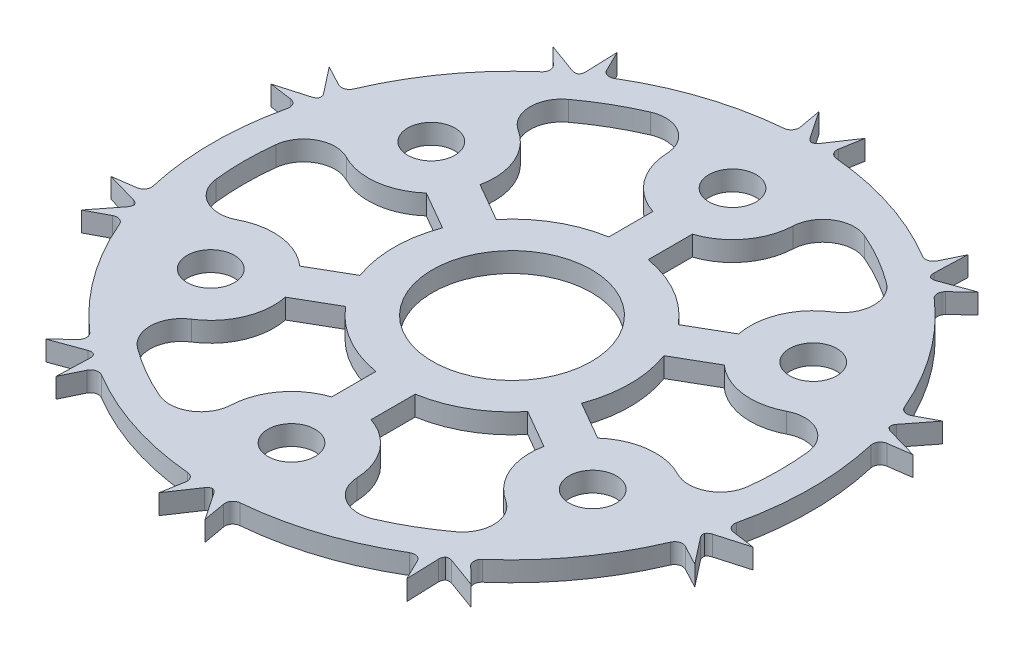
from build123d import *
from build123d.topology import SkipClean

# Parameters (mm, degrees)
SKETCH1_R                = 25.4
BOSS_EXTRUDE1_DEPTH      = 7.62
CUT_EXTRUDE4_DEPTH       = 0.635
CIRPATTERN2_COUNT        = 20
BOSS_EXTRUDE2_REACH      = 36.931
SKETCH5_R                = 3.81
SKETCH5_R_2              = 1.397
BOSS_EXTRUDE6_REACH      = 36.931
SKETCH12_R               = 3.81
SKETCH17_R               = 1.397
CUT_EXTRUDE5_DEPTH       = 33.341392346
CIRPATTERN1_COUNT        = 3
CUT_EXTRUDE7_DEPTH       = 33.67002223
SKETCH30_R               = 24.13
SKETCH30_R_2             = 21.59
BOSS_EXTRUDE16_DEPTH     = 1.6002
SKETCH31_R               = 1.905
BOSS_EXTRUDE17_DEPTH     = 1.6002
FILLET6_R                = 2.54
CIRPATTERN8_COUNT        = 6
FILLET6_OF_CIRPATTERN8_R = 2.54
BOSS_EXTRUDE18_DEPTH     = 1.6002
FILLET7_R                = 0.635
CIRPATTERN9_COUNT        = 10
FILLET7_OF_CIRPATTERN9_R = 0.635
SKETCH34_R               = 9.525
SKETCH34_R_2             = 6.4135
BOSS_EXTRUDE19_DEPTH     = 1.6002


with BuildPart() as part:
    # Sketch1 → Boss-Extrude1 (new, symmetric)
    with BuildSketch(Plane(origin=(0, 0, 0), x_dir=(1, 0, 0), z_dir=(0, 1, 0))):
        with Locations(Location((0, 0, 0), (0, 0, 90))):
            Circle(SKETCH1_R)
    extrude(amount=BOSS_EXTRUDE1_DEPTH, both=True)

    # Sketch9 → Cut-Extrude4 (cut)
    with BuildSketch(Plane.ZY.offset(25.4)):
        Polygon((-0.635, -7.62), (0.635, -7.62), (0.635, 0), (0.635, 7.62), (-0.635, 7.62), (-0.635, 0), align=None)
    cut_extrude4 = extrude(amount=-CUT_EXTRUDE4_DEPTH, mode=Mode.SUBTRACT)

    # CirPattern2: Cut-Extrude4 ×20 about axis
    cirpattern2_axis = Axis((0, 0, 0), (0, 1, 0))
    for i in range(1, CIRPATTERN2_COUNT):
        add(cut_extrude4.rotate(cirpattern2_axis, i * 360 / CIRPATTERN2_COUNT), mode=Mode.SUBTRACT)

    # Sketch4 → Cut-Revolve2 (revolve, cut)
    with BuildSketch(Plane.XY, mode=Mode.PRIVATE) as cut_revolve2_sk:
        with BuildLine():
            Line((-25.4, -7.62), (-22.225, -7.62))
            Line((-22.225, -7.62), (-22.225, -5.08))
            Line((-22.225, -5.08), (-13.94687024, -1.768748096))
            ThreePointArc((-13.94687024, -1.768748096), (-12.749369479, 0), (-13.94687024, 1.768748096))
            Line((-13.94687024, 1.768748096), (-22.225, 5.08))
            Line((-22.225, 5.08), (-22.225, 7.62))
            Line((-22.225, 7.62), (-25.4, 7.62))
            Line((-25.4, 7.62), (-25.4, -7.62))
        make_face()
    revolve(cut_revolve2_sk.sketch.rotate(Axis((0, -55, 0), (0, 1, 0)), 270), axis=Axis((0, -55, 0), (0, 1, 0)), mode=Mode.SUBTRACT)

    # Sketch5 → Boss-Extrude2 (add, up to next)
    with BuildSketch(Plane(origin=(0, 7.62, 0), x_dir=(1, 0, 0), z_dir=(0, 1, 0)), mode=Mode.PRIVATE) as boss_extrude2_sk1:
        with Locations(Location((0, 17.78, 0), (0, 0, 135.677409987))):
            Circle(SKETCH5_R)
        with Locations(Location((0, 17.78, 0), (0, 0, 168.148952206))):
            Circle(SKETCH5_R_2, mode=Mode.SUBTRACT)
    boss_extrude2_tool1 = extrude(boss_extrude2_sk1.sketch, amount=-BOSS_EXTRUDE2_REACH, mode=Mode.PRIVATE) - part.part
    boss_extrude2 = boss_extrude2_tool1.solids().sort_by_distance((2.648644, 7.62, -15.193257))[0]
    add(boss_extrude2)

    # Sketch12 → Boss-Extrude6 (add, up to next)
    with BuildSketch(Plane(origin=(0, 7.62, 0), x_dir=(1, 0, 0), z_dir=(0, 1, 0)), mode=Mode.PRIVATE) as boss_extrude6_sk1:
        with Locations(Location((-15.397931679, 8.89, 0), (0, 0, 134.328577967))):
            Circle(SKETCH12_R)
    boss_extrude6_tool1 = extrude(boss_extrude6_sk1.sketch, amount=-BOSS_EXTRUDE6_REACH, mode=Mode.PRIVATE) - part.part
    boss_extrude6 = boss_extrude6_tool1.solids().sort_by_distance((-15.397932, 7.62, -8.89))[0]
    add(boss_extrude6)

    # Sketch17 → Cut-Extrude5 (cut, symmetric)
    with BuildSketch(Plane(origin=(0, 0, 0), x_dir=(1, 0, 0), z_dir=(0, 1, 0))):
        with Locations(Location((0, 17.78, 0), (0, 0, 270))):
            Circle(SKETCH17_R)
        with Locations(Location((-15.397931679, 8.89, 0), (0, 0, 270))):
            Circle(SKETCH17_R)
        with Locations(Location((-15.397931679, -8.89, 0), (0, 0, 270))):
            Circle(SKETCH17_R)
        with BuildLine():
            Line((-18.697488468, -10.795), (-19.247414599, -11.1125))
            ThreePointArc((-19.247414599, -11.1125), (-19.247414599, 11.1125), (0, 22.225))
            Line((0, 22.225), (0, 21.59))
            ThreePointArc((0, 21.59), (-2.694076836, 20.474076836), (-3.81, 17.78))
            Line((-3.81, 17.78), (-3.81, 15.411019596))
            ThreePointArc((-3.81, 15.411019596), (-7.9375, 13.748153285), (-11.441334469, 11.005066587))
            Line((-11.441334469, 11.005066587), (-13.492931679, 12.189556788))
            ThreePointArc((-13.492931679, 12.189556788), (-18.697488468, 10.795), (-17.302931679, 5.590443212))
            Line((-17.302931679, 5.590443212), (-15.251334469, 4.40595301))
            ThreePointArc((-15.251334469, 4.40595301), (-15.875, 0), (-15.251334469, -4.40595301))
            Line((-15.251334469, -4.40595301), (-17.302931679, -5.590443212))
            ThreePointArc((-17.302931679, -5.590443212), (-19.078109077, -7.903899438), (-18.697488468, -10.795))
        make_face()
    cut_extrude5 = extrude(amount=CUT_EXTRUDE5_DEPTH, both=True, mode=Mode.SUBTRACT)

    # CirPattern1: Boss-Extrude2, Boss-Extrude6, Cut-Extrude5 ×3 about axis
    with SkipClean():  # the faces are left unmerged after this step: merging them gives an invalid solid
        cirpattern1_axis = Axis((0, 0, 0), (0, 1, 0))
        add([boss_extrude2.rotate(cirpattern1_axis, i * 360 / CIRPATTERN1_COUNT) for i in range(1, CIRPATTERN1_COUNT)])
        add([boss_extrude6.rotate(cirpattern1_axis, i * 360 / CIRPATTERN1_COUNT) for i in range(1, CIRPATTERN1_COUNT)])
        add([cut_extrude5.rotate(cirpattern1_axis, i * 360 / CIRPATTERN1_COUNT) for i in range(1, CIRPATTERN1_COUNT)], mode=Mode.SUBTRACT)

    # Sketch24 → Cut-Extrude7 (cut, through all)
    with BuildSketch(Plane.XZ.offset(7.62)):
        Polygon((5.499261314, -9.525), (10.998522628, 0), (5.499261314, 9.525), (-5.499261314, 9.525), (-10.998522628, 0), (-5.499261314, -9.525), align=None)
    extrude(amount=-CUT_EXTRUDE7_DEPTH, mode=Mode.SUBTRACT)


with BuildPart() as body_2:
    # Sketch30 → Boss-Extrude16 (new body)
    with BuildSketch(Plane.XZ.offset(7.62)):
        with Locations(Location((0, 0, 0), (0, 0, 270))):
            Circle(SKETCH30_R)
        with Locations(Location((0, 0, 0), (0, 0, 270))):
            Circle(SKETCH30_R_2, mode=Mode.SUBTRACT)
    extrude(amount=BOSS_EXTRUDE16_DEPTH)

    # Sketch31 → Boss-Extrude17 (add)
    with BuildSketch(Plane.XZ.offset(9.2202)):
        with BuildLine():
            Line((-5.08, 17.78), (-5.08, 23.589203039))
            Line((-5.08, 23.589203039), (5.08, 23.589203039))
            Line((5.08, 23.589203039), (5.08, 17.78))
            ThreePointArc((5.08, 17.78), (4.115270343, 14.801585993), (1.5875, 12.954417781))
            Line((1.5875, 12.954417781), (1.5875, 7.62))
            Line((1.5875, 7.62), (-1.5875, 7.62))
            Line((-1.5875, 7.62), (-1.5875, 12.954417781))
            ThreePointArc((-1.5875, 12.954417781), (-4.115270343, 14.801585993), (-5.08, 17.78))
        make_face()
        with Locations(Location((0, 17.78, 0), (0, 0, 270))):
            Circle(SKETCH31_R, mode=Mode.SUBTRACT)
    boss_extrude17 = extrude(amount=-BOSS_EXTRUDE17_DEPTH)

    # Fillet6
    fillet6_edges = [body_2.edges().sort_by_distance(p)[0] for p in [
        (5.08, -8.4201, 20.983843785),
        (-5.08, -8.4201, 20.983843785),
    ]]
    fillet(fillet6_edges, radius=FILLET6_R)

    # CirPattern8: Boss-Extrude17 ×6 about axis
    cirpattern8_axis = Axis((0, 0, 0), (0, 1, 0))
    for i in range(1, CIRPATTERN8_COUNT):
        add(boss_extrude17.rotate(cirpattern8_axis, i * 360 / CIRPATTERN8_COUNT))

    # Fillet6 of CirPattern8
    fillet6_of_cirpattern8_edges = [body_2.edges().sort_by_distance(p)[0] for p in [
        (20.712541787, -8.4201, 6.092512841),
        (15.632541787, -8.4201, 14.891330944),
        (15.632541787, -8.4201, -14.891330944),
        (20.712541787, -8.4201, -6.092512841),
        (-5.08, -8.4201, -20.983843785),
        (5.08, -8.4201, -20.983843785),
        (-20.712541787, -8.4201, -6.092512841),
        (-15.632541787, -8.4201, -14.891330944),
        (-15.632541787, -8.4201, 14.891330944),
        (-20.712541787, -8.4201, 6.092512841),
    ]]
    fillet(fillet6_of_cirpattern8_edges, radius=FILLET6_OF_CIRPATTERN8_R)

    # Sketch32 → Boss-Extrude18 (add)
    with BuildSketch(Plane.XZ.offset(9.2202)):
        Polygon((1.860405155, 26.60503322), (0.190467123, 24.129248274), (1.416651103, 24.088378934), align=None)
        Polygon((-1.416651103, 24.088378934), (-1.860405155, 26.60503322), (-0.190467123, 24.129248274), align=None)
    boss_extrude18 = extrude(amount=-BOSS_EXTRUDE18_DEPTH)

    # Fillet7
    # the kernel refuses this fillet: 0.635 mm, written as the material it adds along each edge
    with BuildSketch(Plane(origin=(-0.190467123, -9.2202, 24.129248274), x_dir=(0.9999995200817018, 0, 0.0009797123894977819), z_dir=(0, 1, 0))) as fillet7_piece_1:
        with BuildLine():
            CenterArc((0.338044808, -0.634984824), FILLET7_R, 90.396128338, 55.660005056)
            Line((-0.188741682, -0.280413259), (0, 0))
            ThreePointArc((0, 0), (0.166827308, -0.000576703), (0.333654615, 0))
        make_face()
    extrude(amount=1.6002)
    with BuildSketch(Plane(origin=(-1.416651103, -9.2202, 24.088378934), x_dir=(-0.9973280009375803, 0, -0.07305380582727858), z_dir=(0, 1, 0))) as fillet7_piece_2:
        with BuildLine():
            CenterArc((0.702892362, 0.634934383), FILLET7_R, 174.18940678, 94.986906687)
            Line((0.071154987, 0.699221933), (0, 0))
            ThreePointArc((0, 0), (0.346881945, 0.002493438), (0.69376389, 0))
        make_face()
    extrude(amount=1.6002)
    with BuildSketch(Plane(origin=(1.416651103, -9.2202, 24.088378934), x_dir=(0.9973280009375803, 0, -0.07305380582727927), z_dir=(0, 1, 0))) as fillet7_piece_3:
        with BuildLine():
            CenterArc((0.702892362, -0.634934383), FILLET7_R, 90.823686533, 94.986906687)
            Line((0.071154987, -0.699221933), (0, 0))
            ThreePointArc((0, 0), (0.346881945, -0.002493438), (0.69376389, 0))
        make_face()
    extrude(amount=1.6002)
    with BuildSketch(Plane(origin=(0.190467123, -9.2202, 24.129248274), x_dir=(-0.9999995200817018, 0, 0.0009797123894977626), z_dir=(0, 1, 0))) as fillet7_piece_4:
        with BuildLine():
            CenterArc((0.338044808, 0.634984824), FILLET7_R, 213.943866606, 55.660005056)
            Line((-0.188741682, 0.280413259), (0, 0))
            ThreePointArc((0, 0), (0.166827308, 0.000576703), (0.333654615, 0))
        make_face()
    extrude(amount=1.6002)

    # CirPattern9: Boss-Extrude18 ×10 about axis
    cirpattern9_axis = Axis((0, 0, 0), (0, 1, 0))
    for i in range(1, CIRPATTERN9_COUNT):
        add(boss_extrude18.rotate(cirpattern9_axis, i * 360 / CIRPATTERN9_COUNT))

    # Fillet7 of CirPattern9
    # the kernel refuses this fillet: 0.635 mm, written as the material it adds along each edge
    with BuildSketch(Plane(origin=(14.028725145, -9.2202, 19.632925681), x_dir=(0.03489949670250677, 0, 0.9993908270190954), z_dir=(0, 1, 0)), Plane(origin=(22.889421227, -9.2202, 7.637492776), x_dir=(0.615661475325664, 0, 0.7880107536067176), z_dir=(0, 1, 0)), Plane(origin=(23.007136382, -9.2202, -7.27520278), x_dir=(0.9612616959383196, 0, 0.27563735581699683), z_dir=(0, 1, 0)), Plane(origin=(14.336907424, -9.2202, -19.40901815), x_dir=(0.9396926207859054, 0, -0.34202014332567665), z_dir=(0, 1, 0)), Plane(origin=(0.190467123, -9.2202, -24.129248274), x_dir=(0.559192903470741, 0, -0.8290375725550456), z_dir=(0, 1, 0)), Plane(origin=(-14.028725145, -9.2202, -19.632925681), x_dir=(-0.03489949670250263, 0, -0.9993908270190958), z_dir=(0, 1, 0)), Plane(origin=(-22.889421227, -9.2202, -7.637492776), x_dir=(-0.6156614753256622, 0, -0.7880107536067188), z_dir=(0, 1, 0)), Plane(origin=(-23.007136382, -9.2202, 7.27520278), x_dir=(-0.9612616959383196, 0, -0.27563735581699694), z_dir=(0, 1, 0))) as fillet7_of_cirpattern9_piece_1:
        with BuildLine():
            CenterArc((0.338016299, 0.635), FILLET7_OF_CIRPATTERN9_R, 214.339994944, 55.660005056)
            ThreePointArc((-0.186306203, 0.276794872), (-0.092674677, 0.138719456), (0, 0))
            Line((0, 0), (0.338016299, 0))
        make_face()
    extrude(amount=1.6002)
    with BuildSketch(Plane(origin=(13.012699072, -9.2202, 20.32059455), x_dir=(-0.8497952514136049, 0, 0.527112920231413), z_dir=(0, 1, 0)), Plane(origin=(22.471640486, -9.2202, 8.79103372), x_dir=(-0.37766959932788574, 0, 0.9259404266709139), z_dir=(0, 1, 0)), Plane(origin=(23.347179018, -9.2202, -6.096403195), x_dir=(0.23871300318352556, 0, 0.9710901616796981), z_dir=(0, 1, 0)), Plane(origin=(15.304888706, -9.2202, -18.655221298), x_dir=(0.7639153520353841, 0, 0.6453164610674791), z_dir=(0, 1, 0)), Plane(origin=(1.416651103, -9.2202, -24.088378934), x_dir=(0.9973280009375805, 0, 0.07305380582727697), z_dir=(0, 1, 0)), Plane(origin=(-13.012699072, -9.2202, -20.32059455), x_dir=(0.8497952514136128, 0, -0.5271129202314003), z_dir=(0, 1, 0)), Plane(origin=(-22.471640486, -9.2202, -8.79103372), x_dir=(0.37766959932791355, 0, -0.9259404266709027), z_dir=(0, 1, 0)), Plane(origin=(-23.347179018, -9.2202, 6.096403195), x_dir=(-0.23871300318349162, 0, -0.9710901616797064), z_dir=(0, 1, 0)), Plane(origin=(-15.304888706, -9.2202, 18.655221298), x_dir=(-0.7639153520353762, 0, -0.6453164610674884), z_dir=(0, 1, 0))) as fillet7_of_cirpattern9_piece_2:
        with BuildLine():
            CenterArc((0.702892362, 0.634934383), FILLET7_OF_CIRPATTERN9_R, 174.18940678, 94.986906687)
            Line((0.071154987, 0.699221933), (0, 0))
            ThreePointArc((0, 0), (0.346881945, 0.002493438), (0.69376389, 0))
        make_face()
    extrude(amount=1.6002)
    with BuildSketch(Plane(origin=(15.304888706, -9.2202, 18.655221298), x_dir=(0.7193398003386516, 0, 0.6946583704589967), z_dir=(0, 1, 0)), Plane(origin=(23.347179018, -9.2202, 6.096403195), x_dir=(0.9902680687415706, 0, 0.13917310096006394), z_dir=(0, 1, 0)), Plane(origin=(22.471640486, -9.2202, -8.79103372), x_dir=(0.8829475928589268, 0, -0.46947156278589125), z_dir=(0, 1, 0)), Plane(origin=(13.012699072, -9.2202, -20.32059455), x_dir=(0.4383711467890756, 0, -0.8987940462991678), z_dir=(0, 1, 0)), Plane(origin=(-1.416651103, -9.2202, -24.088378934), x_dir=(-0.17364817766693175, 0, -0.9848077530122078), z_dir=(0, 1, 0)), Plane(origin=(-15.304888706, -9.2202, -18.655221298), x_dir=(-0.7193398003386523, 0, -0.6946583704589961), z_dir=(0, 1, 0)), Plane(origin=(-23.347179018, -9.2202, -6.096403195), x_dir=(-0.9902680687415706, 0, -0.13917310096006316), z_dir=(0, 1, 0)), Plane(origin=(-22.471640486, -9.2202, 8.79103372), x_dir=(-0.8829475928589264, 0, 0.46947156278589175), z_dir=(0, 1, 0))) as fillet7_of_cirpattern9_piece_3:
        with BuildLine():
            CenterArc((0.702833084, 0.635), FILLET7_OF_CIRPATTERN9_R, 175.013093313, 94.986906687)
            ThreePointArc((0.07023682, 0.690199336), (0.037599036, 0.344847232), (0, 0))
            Line((0, 0), (0.702833084, 0))
        make_face()
    extrude(amount=1.6002)
    with BuildSketch(Plane(origin=(14.336907424, -9.2202, 19.40901815), x_dir=(-0.8084407456188444, 0, 0.5885775741762905), z_dir=(0, 1, 0)), Plane(origin=(23.007136382, -9.2202, 7.27520278), x_dir=(-0.3080850842198965, 0, 0.9513588076436879), z_dir=(0, 1, 0)), Plane(origin=(22.889421227, -9.2202, -7.637492776), x_dir=(0.30994860792420126, 0, 0.9507533120877623), z_dir=(0, 1, 0)), Plane(origin=(14.028725145, -9.2202, -19.632925681), x_dir=(0.8095924666069352, 0, 0.5869923662308553), z_dir=(0, 1, 0)), Plane(origin=(-0.190467123, -9.2202, -24.129248274), x_dir=(0.9999995200817018, 0, -0.000979712389497761), z_dir=(0, 1, 0)), Plane(origin=(-14.336907424, -9.2202, -19.40901815), x_dir=(0.8084407456188637, 0, -0.588577574176264), z_dir=(0, 1, 0)), Plane(origin=(-23.007136382, -9.2202, -7.27520278), x_dir=(0.30808508421995306, 0, -0.9513588076436695), z_dir=(0, 1, 0)), Plane(origin=(-22.889421227, -9.2202, 7.637492776), x_dir=(-0.30994860792414214, 0, -0.9507533120877815), z_dir=(0, 1, 0)), Plane(origin=(-14.028725145, -9.2202, 19.632925681), x_dir=(-0.8095924666069085, 0, -0.5869923662308921), z_dir=(0, 1, 0))) as fillet7_of_cirpattern9_piece_4:
        with BuildLine():
            CenterArc((0.338044808, 0.634984824), FILLET7_OF_CIRPATTERN9_R, 213.943866606, 55.660005056)
            Line((-0.188741682, 0.280413259), (0, 0))
            ThreePointArc((0, 0), (0.166827308, 0.000576703), (0.333654615, 0))
        make_face()
    extrude(amount=1.6002)
    with BuildSketch(Plane(origin=(-14.336907424, -9.2202, 19.40901815), x_dir=(0.8084407456188606, 0, 0.5885775741762684), z_dir=(0, 1, 0))) as fillet7_of_cirpattern9_piece_5:
        with BuildLine():
            CenterArc((0.338044808, -0.634984824), FILLET7_OF_CIRPATTERN9_R, 90.396128338, 55.660005056)
            Line((-0.188741682, -0.280413259), (0, 0))
            ThreePointArc((0, 0), (0.166827308, -0.000576703), (0.333654615, 0))
        make_face()
    extrude(amount=1.6002)
    with BuildSketch(Plane(origin=(-13.012699072, -9.2202, 20.32059455), x_dir=(0.8497952514136161, 0, 0.5271129202313952), z_dir=(0, 1, 0))) as fillet7_of_cirpattern9_piece_6:
        with BuildLine():
            CenterArc((0.702892362, -0.634934383), FILLET7_OF_CIRPATTERN9_R, 90.823686533, 94.986906687)
            Line((0.071154987, -0.699221933), (0, 0))
            ThreePointArc((0, 0), (0.346881945, -0.002493438), (0.69376389, 0))
        make_face()
    extrude(amount=1.6002)

    # Sketch34 → Boss-Extrude19 (add)
    with BuildSketch(Plane.XZ.offset(9.2202)):
        Circle(SKETCH34_R)
        with Locations(Location((0, 0, 0), (0, 0, 270))):
            Circle(SKETCH34_R_2, mode=Mode.SUBTRACT)
    extrude(amount=-BOSS_EXTRUDE19_DEPTH)


solid = body_2.part
